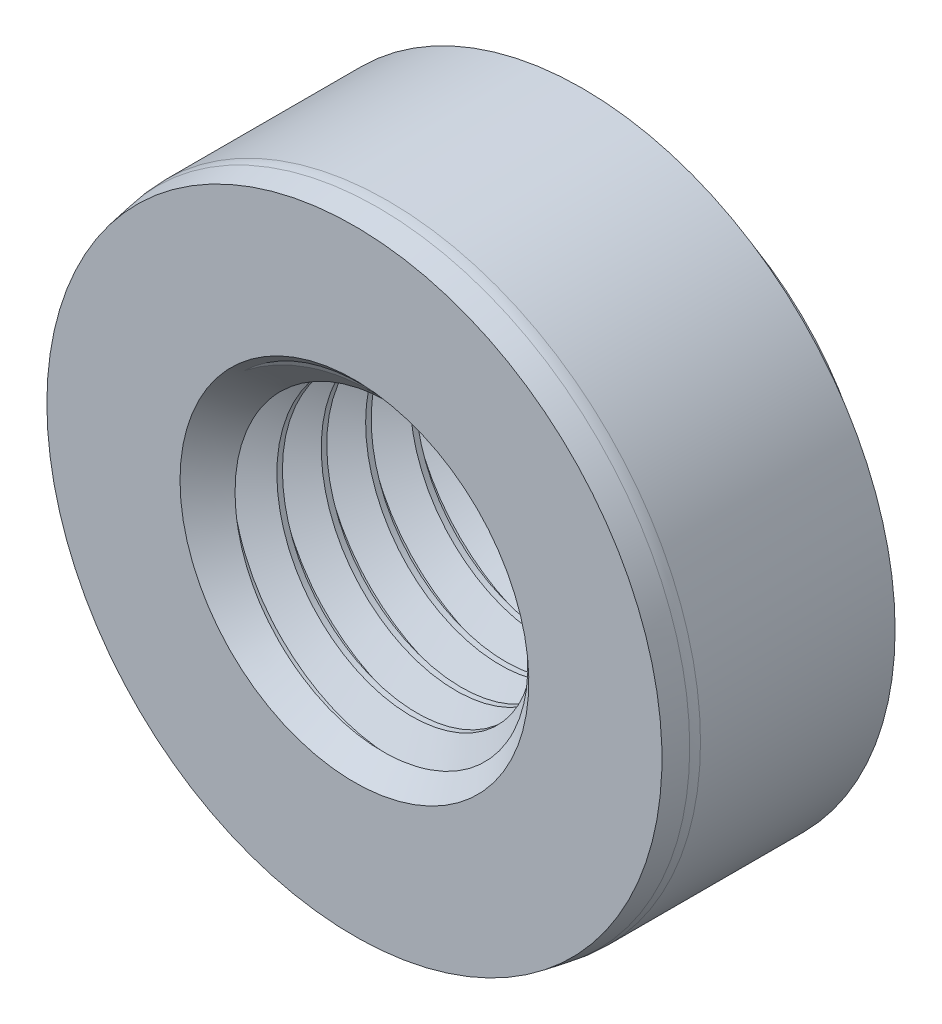
from build123d import *

# Parameters (mm, degrees)
CUT_EXTRUDE2_START           = -0.237333333
CUT_EXTRUDE2_DEPTH           = 0.237333333
FILLET3_R                    = 0.2194075
CIRPATTERN1_COUNT            = 24
FILLET3_OF_CIRPATTERN1_R     = 0.2194075
FILLET4_R                    = 0.2194075
SKETCH12_W                   = 4.97
SKETCH12_H                   = 3
CHAMFER1_SIZE                = 0.51
CHAMFER1_SIZE2               = 0.08992676
FILLET5_R                    = 1.02
SWEEP1_PITCH                 = 0.79375
SWEEP1_HEIGHT                = 5.76375
SWEEP1_RADIUS                = 3
SWEEP1_START_ANGLE           = 90
SKETCH15_R                   = 3.1190625
CUT_EXTRUDE3_OTHER_WAY_DEPTH = 10.798141087
CUT_EXTRUDE3_OTHER_WAY_TAPER = -47
SKETCH16_R                   = 3.1190625
CUT_EXTRUDE4_OTHER_WAY_DEPTH = 10.337938918
CUT_EXTRUDE4_OTHER_WAY_TAPER = -47


with BuildPart() as part:
    # Sketch2 → Revolve1 (revolve)
    with BuildSketch(Plane(origin=(0, 0, 0), x_dir=(0, 0, -1), z_dir=(1, 0, 0)), mode=Mode.PRIVATE) as revolve1_sk:
        Polygon((0, 0), (0, 4.365), (-0.296666667, 4.365), (-0.652666667, 4.269610087), (-0.652666667, 5.17075), (-0.89, 5.17075), (-0.89, 5.59), (-4.97, 5.59), (-4.97, 0), align=None)
    revolve(revolve1_sk.sketch.rotate(Axis((0, 0, 4.97), (0, 0, -1)), 90), axis=Axis((0, 0, 4.97), (0, 0, -1)))

    # Sketch5 → Cut-Extrude2 (cut)
    with BuildSketch(Plane(origin=(0, 0, 0.652666667), x_dir=(-1, 0, 0), z_dir=(0, 0, -1)).offset(CUT_EXTRUDE2_START)):
        with BuildLine():
            Line((-5.119113982, -0.728922218), (-4.653675, 0))
            Line((-4.653675, 0), (-5.119113982, 0.728922218))
            ThreePointArc((-5.119113982, 0.728922218), (-5.17075, 0), (-5.119113982, -0.728922218))
        make_face()
    cut_extrude2 = extrude(amount=CUT_EXTRUDE2_DEPTH, mode=Mode.SUBTRACT)

    # Fillet3
    fillet3_edges = [part.edges().sort_by_distance(p)[0] for p in [
        (4.653675, 0, 0.771333333),
    ]]
    fillet(fillet3_edges, radius=FILLET3_R)

    # CirPattern1: Cut-Extrude2 ×24 about axis
    cirpattern1_axis = Axis((0, 0, 0), (0, 0, 1))
    for i in range(1, CIRPATTERN1_COUNT):
        add(cut_extrude2.rotate(cirpattern1_axis, i * 360 / CIRPATTERN1_COUNT), mode=Mode.SUBTRACT)

    # Fillet3 of CirPattern1
    fillet3_of_cirpattern1_edges = [part.edges().sort_by_distance(p)[0] for p in [
        (4.49510487, 1.20445972, 0.771333333),
        (4.030200771, 2.3268375, 0.771333333),
        (3.29064515, 3.29064515, 0.771333333),
        (2.3268375, 4.030200771, 0.771333333),
        (1.20445972, 4.49510487, 0.771333333),
        (0, 4.653675, 0.771333333),
        (-1.20445972, 4.49510487, 0.771333333),
        (-2.3268375, 4.030200771, 0.771333333),
        (-3.29064515, 3.29064515, 0.771333333),
        (-4.030200771, 2.3268375, 0.771333333),
        (-4.49510487, 1.20445972, 0.771333333),
        (-4.653675, 0, 0.771333333),
        (-4.49510487, -1.20445972, 0.771333333),
        (-4.030200771, -2.3268375, 0.771333333),
        (-3.29064515, -3.29064515, 0.771333333),
        (-2.3268375, -4.030200771, 0.771333333),
        (-1.20445972, -4.49510487, 0.771333333),
        (0, -4.653675, 0.771333333),
        (1.20445972, -4.49510487, 0.771333333),
        (2.3268375, -4.030200771, 0.771333333),
        (3.29064515, -3.29064515, 0.771333333),
        (4.030200771, -2.3268375, 0.771333333),
        (4.49510487, -1.20445972, 0.771333333),
    ]]
    fillet(fillet3_of_cirpattern1_edges, radius=FILLET3_OF_CIRPATTERN1_R)

    # Fillet4
    fillet4_edges = [part.edges().sort_by_distance(p)[0] for p in [
        (5.080786875, 0.668898282, 0.771333333),
        (5.080786875, -0.668898282, 0.771333333),
        (4.734539646, 1.961110533, 0.771333333),
        (4.065641364, 3.119676342, 0.771333333),
        (3.119676342, 4.065641364, 0.771333333),
        (1.961110533, 4.734539646, 0.771333333),
        (0.668898282, 5.080786875, 0.771333333),
        (-0.668898282, 5.080786875, 0.771333333),
        (-1.961110533, 4.734539646, 0.771333333),
        (-3.119676342, 4.065641364, 0.771333333),
        (-4.065641364, 3.119676342, 0.771333333),
        (-4.734539646, 1.961110533, 0.771333333),
        (-5.080786875, 0.668898282, 0.771333333),
        (-5.080786875, -0.668898282, 0.771333333),
        (-4.734539646, -1.961110533, 0.771333333),
        (-4.065641364, -3.119676342, 0.771333333),
        (-3.119676342, -4.065641364, 0.771333333),
        (-1.961110533, -4.734539646, 0.771333333),
        (-0.668898282, -5.080786875, 0.771333333),
        (0.668898282, -5.080786875, 0.771333333),
        (1.961110533, -4.734539646, 0.771333333),
        (3.119676342, -4.065641364, 0.771333333),
        (4.065641364, -3.119676342, 0.771333333),
        (4.734539646, -1.961110533, 0.771333333),
    ]]
    fillet(fillet4_edges, radius=FILLET4_R)

    # Sketch11 → Cut-Revolve3 (revolve, cut)
    with BuildSketch(Plane(origin=(0, 0, 0), x_dir=(1, 0, 0), z_dir=(0, 1, 0))):
        Polygon((4.653675, -0.652666667), (5.17075, -0.840866576), (5.17075, -0.652666667), align=None)
    revolve(axis=Axis((0, 0, 4.97), (0, 0, -1)), mode=Mode.SUBTRACT)

    # Sketch12 → Cut-Revolve4 (revolve, cut)
    with BuildSketch(Plane(origin=(0, 0, 0), x_dir=(0, 0, -1), z_dir=(1, 0, 0)), mode=Mode.PRIVATE) as cut_revolve4_sk:
        with Locations((-2.485, -1.5)):
            Rectangle(SKETCH12_W, SKETCH12_H)
    revolve(cut_revolve4_sk.sketch.rotate(Axis((0, 0, 4.97), (0, 0, -1)), 270), axis=Axis((0, 0, 4.97), (0, 0, -1)), mode=Mode.SUBTRACT)

    # Chamfer1
    chamfer1_edges = [part.edges().sort_by_distance(p)[0] for p in [
        (-5.59, 0, 4.97),
    ]]
    chamfer1_side = [part.faces().sort_by_distance(p)[0] for p in [
        (-5.59, 0, 2.93),
    ]]
    chamfer(chamfer1_edges, length=CHAMFER1_SIZE, length2=CHAMFER1_SIZE2, reference=chamfer1_side[0])

    # Fillet5
    fillet5_edges = [part.edges().sort_by_distance(p)[0] for p in [
        (-5.59, 0, 4.46),
        (-4.365, 0, 0.296666667),
    ]]
    fillet(fillet5_edges, radius=FILLET5_R)

    # Sweep1: sweep along a helix
    with BuildLine() as sweep1_path:
        add(Helix(SWEEP1_PITCH, SWEEP1_HEIGHT, SWEEP1_RADIUS, center=(0, 0, 0), direction=(0, 0, 1), mode=Mode.PRIVATE).rotate(Axis((0, 0, 0), (0, 0, 1)), SWEEP1_START_ANGLE))
    # Sketch14 → Sweep1 (sweep)
    with BuildSketch(Plane(origin=(0, 0, 0), x_dir=(0, 0, -1), z_dir=(1, 0, 0))):
        Polygon((-0.024804687, 3.042962979), (0.719335937, 3.042962979), (0.396875, 2.484444252), (0.29765625, 2.484444252), align=None)
    sweep(path=sweep1_path.line, is_frenet=True)

    # Cut-Extrude3 cone 1 section (through the dimple's axis) → Cut-Extrude3 (revolve, cut)
    with BuildSketch(Plane.YZ):
        Polygon((0, 0), (3.1190625, 0), (0, 2.908572836), align=None)
    revolve(axis=Axis((0, 0, 0), (0, 0, 1)), mode=Mode.SUBTRACT)

    # Sketch15 → Cut-Extrude3 other way (cut)
    with BuildSketch(Plane(origin=(0, 0, 0), x_dir=(-1, 0, 0), z_dir=(0, 0, -1))):
        Circle(SKETCH15_R)
    extrude(amount=CUT_EXTRUDE3_OTHER_WAY_DEPTH, taper=CUT_EXTRUDE3_OTHER_WAY_TAPER, mode=Mode.SUBTRACT)

    # Cut-Extrude4 cone 1 section (through the dimple's axis) → Cut-Extrude4 (revolve, cut)
    with BuildSketch(Plane(origin=(0, 0, 4.97), x_dir=(0, -1, 0), z_dir=(1, 0, 0))):
        Polygon((0, 0), (3.1190625, 0), (0, 2.908572836), align=None)
    revolve(axis=Axis((0, 0, 4.97), (0, 0, -1)), mode=Mode.SUBTRACT)

    # Sketch16 → Cut-Extrude4 other way (cut)
    with BuildSketch(Plane.XY.offset(4.97)):
        Circle(SKETCH16_R)
    extrude(amount=CUT_EXTRUDE4_OTHER_WAY_DEPTH, taper=CUT_EXTRUDE4_OTHER_WAY_TAPER, mode=Mode.SUBTRACT)


solid = part.part
